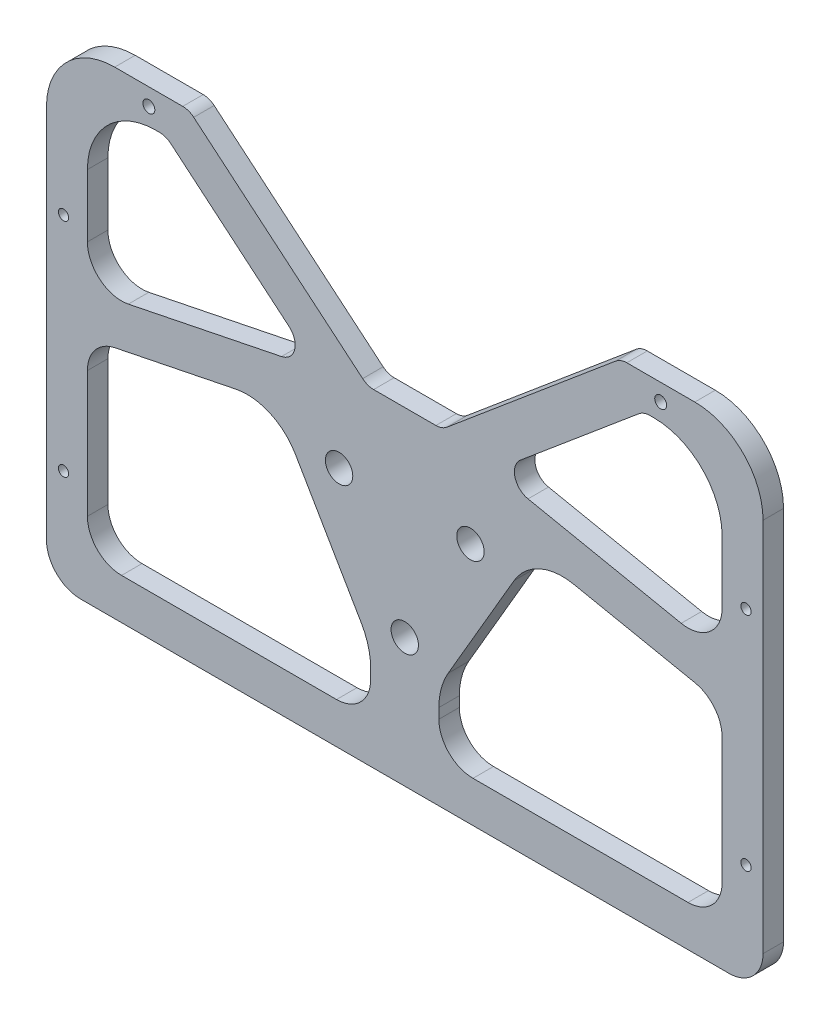
from build123d import *

# Parameters (mm, degrees)
BOSS_EXTRUDE1_DEPTH          = 3
CUT_EXTRUDE1_DEPTH           = 133.140077191
CUT_EXTRUDE1_DEPTH_BACK      = 133.140077191
SKETCH2_R                    = 1.5
O_0_316_DIAMETER_HOLE1_D     = 8.0264
O_0_316_DIAMETER_HOLE1_DEPTH = 10
O_0_316_DIAMETER_HOLE1_TIP   = 2.411373836
SKETCH6_W                    = 140
SKETCH6_H                    = 10
CUT_EXTRUDE2_DEPTH           = 10
SKETCH7_R                    = 1.75
CUT_EXTRUDE3_DEPTH           = 10
BOSS_EXTRUDE3_DEPTH          = 6
FILLET2_R                    = 5


with BuildPart() as part:
    # Sketch1 → Boss-Extrude1 (new, symmetric)
    with BuildSketch(Plane.XY):
        with BuildLine():
            Line((-95, -60), (95, -60))
            ThreePointArc((95, -60), (102.071067812, -57.071067812), (105, -50))
            Line((105, -50), (105, 60))
            ThreePointArc((105, 60), (99.142135624, 74.142135624), (85, 80))
            Line((85, 80), (-85, 80))
            ThreePointArc((-85, 80), (-99.142135624, 74.142135624), (-105, 60))
            Line((-105, 60), (-105, -50))
            ThreePointArc((-105, -50), (-102.071067812, -57.071067812), (-95, -60))
        make_face()
        with BuildLine():
            Line((93, -1.00460734), (93, -38))
            ThreePointArc((93, -38), (90.071067812, -45.071067812), (83, -48))
            Line((83, -48), (20, -48))
            ThreePointArc((20, -48), (12.928932188, -45.071067812), (10, -38))
            Line((10, -38), (10, -35.031250653))
            ThreePointArc((10, -35.031250653), (10.691550782, -29.817443139), (12.71837888, -24.964196891))
            Line((12.71837888, -24.964196891), (32.056244976, 8.232176449))
            ThreePointArc((32.056244976, 8.232176449), (39.499751599, 14.924573129), (49.448622011, 16.026363354))
            Line((49.448622011, 16.026363354), (84.993679344, 8.794639706))
            ThreePointArc((84.993679344, 8.794639706), (90.743926441, 5.322445946), (93, -1.00460734))
        make_face(mode=Mode.SUBTRACT)
        with BuildLine():
            Line((-83, -48), (-20, -48))
            ThreePointArc((-20, -48), (-12.928932188, -45.071067812), (-10, -38))
            Line((-10, -38), (-10, -35.031250653))
            ThreePointArc((-10, -35.031250653), (-10.691550782, -29.817443139), (-12.71837888, -24.964196891))
            Line((-12.71837888, -24.964196891), (-32.056244976, 8.232176449))
            ThreePointArc((-32.056244976, 8.232176449), (-39.499751599, 14.924573129), (-49.448622011, 16.026363354))
            Line((-49.448622011, 16.026363354), (-84.993679344, 8.794639706))
            ThreePointArc((-84.993679344, 8.794639706), (-90.743926441, 5.322445946), (-93, -1.00460734))
            Line((-93, -1.00460734), (-93, -38))
            ThreePointArc((-93, -38), (-90.071067812, -45.071067812), (-83, -48))
        make_face(mode=Mode.SUBTRACT)
        with BuildLine():
            Line((-93, 31.650962878), (-93, 50))
            ThreePointArc((-93, 50), (-87.142135624, 64.142135624), (-73, 70))
            Line((-73, 70), (73, 70))
            ThreePointArc((73, 70), (87.142135624, 64.142135624), (93, 50))
            Line((93, 50), (93, 31.650962878))
            ThreePointArc((93, 31.650962878), (89.327053286, 23.907036437), (81.006320656, 21.851715832))
            Line((81.006320656, 21.851715832), (42.92968902, 29.598494092))
            ThreePointArc((42.92968902, 29.598494092), (40.946091564, 29.899370365), (38.942330332, 30))
            Line((38.942330332, 30), (-38.942330332, 30))
            ThreePointArc((-38.942330332, 30), (-40.946091564, 29.899370365), (-42.92968902, 29.598494092))
            Line((-42.92968902, 29.598494092), (-81.006320656, 21.851715832))
            ThreePointArc((-81.006320656, 21.851715832), (-89.327053286, 23.907036437), (-93, 31.650962878))
        make_face(mode=Mode.SUBTRACT)
    extrude(amount=BOSS_EXTRUDE1_DEPTH, both=True)

    # Sketch2 → Cut-Extrude1 (cut, two sides: drawn at the far end of the back side and taken through both)
    with BuildSketch(Plane.XY.offset(3).offset(-CUT_EXTRUDE1_DEPTH_BACK)):
        with Locations((100, 35)):
            Circle(SKETCH2_R)
        with Locations((100, -30)):
            Circle(SKETCH2_R)
        with Locations((-100, -30)):
            Circle(SKETCH2_R)
        with Locations((-100, 35)):
            Circle(SKETCH2_R)
    extrude(amount=CUT_EXTRUDE1_DEPTH + CUT_EXTRUDE1_DEPTH_BACK, mode=Mode.SUBTRACT)

    # O (0.316) Diameter Hole1
    with Locations(Plane.XY.offset(3)):
        with Locations((-19.247414599, 11.1125), (19.247414599, 11.1125), (0, -22.225)):
            Hole(O_0_316_DIAMETER_HOLE1_D / 2, depth=O_0_316_DIAMETER_HOLE1_DEPTH)
            with Locations((0, 0, -(O_0_316_DIAMETER_HOLE1_DEPTH + O_0_316_DIAMETER_HOLE1_TIP / 2))):  # 118° drill point
                Cone(0, O_0_316_DIAMETER_HOLE1_D / 2, O_0_316_DIAMETER_HOLE1_TIP, mode=Mode.SUBTRACT)

    # Sketch6 → Cut-Extrude2 (cut)
    with BuildSketch(Plane.XY.offset(3)):
        with Locations((0, 75)):
            Rectangle(SKETCH6_W, SKETCH6_H)
    extrude(amount=-CUT_EXTRUDE2_DEPTH, mode=Mode.SUBTRACT)

    # Sketch7 → Cut-Extrude3 (cut)
    with BuildSketch(Plane.XY.offset(3)):
        with Locations((-75, 75)):
            Circle(SKETCH7_R)
        with Locations((75, 75)):
            Circle(SKETCH7_R)
    extrude(amount=-CUT_EXTRUDE3_DEPTH, mode=Mode.SUBTRACT)

    # Sketch8 → Boss-Extrude3 (add)
    with BuildSketch(Plane(origin=(0, 0, -3), x_dir=(-1, 0, 0), z_dir=(0, 0, -1))):
        Polygon((-63.248850004, 80), (-70, 80), (-70, 70), (-25.96476149, 33.050047608), (-42.92968902, 29.598494092), (42.92968902, 29.598494092), (25.96476149, 33.050047608), (70, 70), (70, 80), (69.821528384, 80), (63.248850004, 80), (10.939239008, 36.107024707), (-10.939239008, 36.107024707), align=None)
    extrude(amount=-BOSS_EXTRUDE3_DEPTH)

    # Fillet2
    fillet2_edges = [part.edges().sort_by_distance(p)[0] for p in [
        (-70, 70, 0),
        (70, 70, 0),
        (-63.248850004, 80, 0),
        (63.248850004, 80, 0),
        (10.939239008, 36.107024707, 0),
        (-10.939239008, 36.107024707, 0),
        (-25.96476149, 33.050047608, 0),
        (25.96476149, 33.050047608, 0),
    ]]
    fillet(fillet2_edges, radius=FILLET2_R)


solid = part.part
